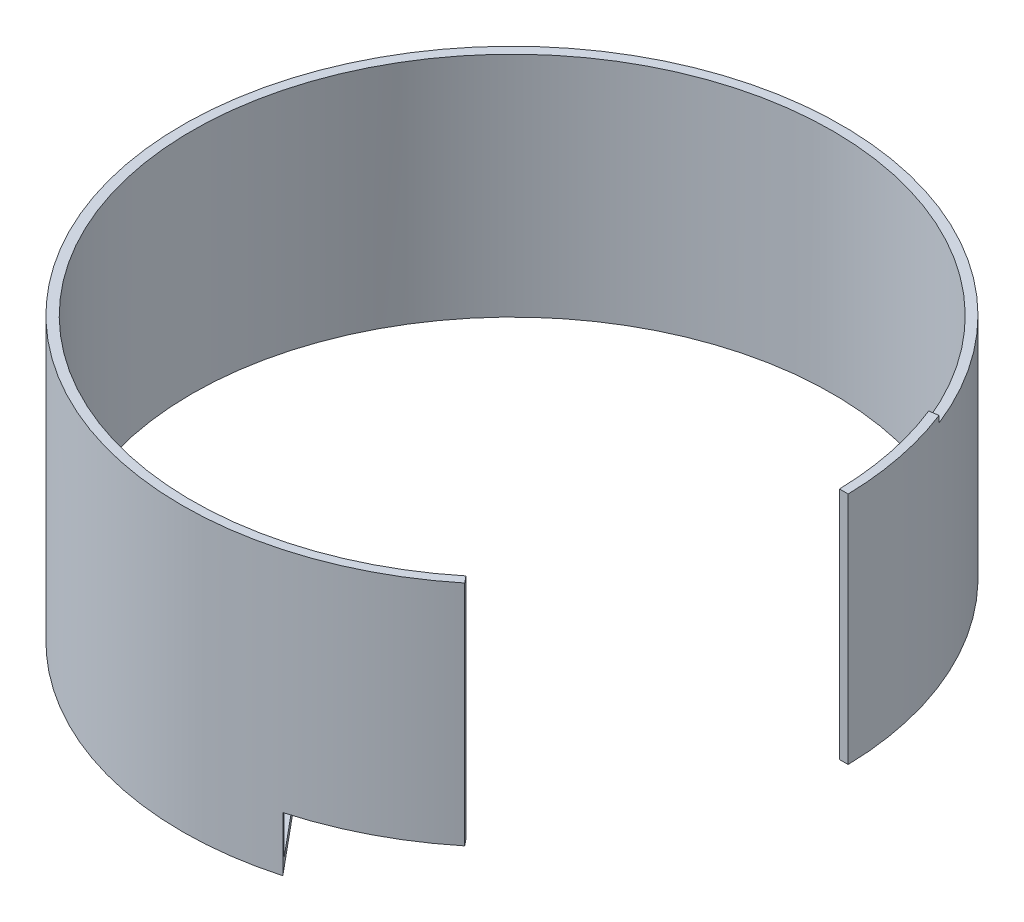
from build123d import *

# Parameters (mm, degrees)
BASE_FLANGE1_DEPTH  = 98.298
CUT_EXTRUDE1_START  = -19.939
CUT_EXTRUDE1_DEPTH  = 19.939
BOSS_EXTRUDE3_START = -3.175
SKETCH13_R          = 3.5
BOSS_EXTRUDE3_DEPTH = 3.175
BOSS_EXTRUDE4_START = 4.572
BOSS_EXTRUDE4_DEPTH = 4.572
BOSS_EXTRUDE5_START = 2.4115014
BOSS_EXTRUDE5_DEPTH = 2.4115014


# Sheet-metal steps are written as plain solids
with BuildPart() as part:
    # Sketch3 → Base-Flange1 (new body)
    with BuildSketch(Plane(origin=(0, 0, 0), x_dir=(1, 0, 0), z_dir=(0, 1, 0))):
        with BuildLine():
            Line((116.647348933, 2.54), (119.822348933, 2.54))
            ThreePointArc((119.822348933, 2.54), (-109.127582861, 50.474671088), (75.651891683, -92.955973295))
            Line((75.651891683, -92.955973295), (73.645289253, -90.495452836))
            ThreePointArc((73.645289253, -90.495452836), (-105.909021844, 48.952371802), (116.647348933, 2.54))
        make_face()
    extrude(amount=-BASE_FLANGE1_DEPTH)

    # Sketch11 → Cut-Extrude1 (cut)
    with BuildSketch(Plane.XZ.offset(98.298).offset(CUT_EXTRUDE1_START)):
        with BuildLine():
            Line((32.000435674, 115.55214828), (29.730194096, 112.823628607))
            ThreePointArc((29.730194096, 112.823628607), (52.879669985, 104.003827407), (73.645289253, 90.495452836))
            Line((73.645289253, 90.495452836), (75.651891683, 92.955973295))
            ThreePointArc((75.651891683, 92.955973295), (54.995189309, 106.512393046), (32.000435674, 115.55214828))
        make_face()
        with BuildLine():
            Line((-92.337333522, 76.828501251), (-89.68916988, 74.625119225))
            ThreePointArc((-89.68916988, 74.625119225), (-40.869300957, -109.282916562), (116.647348933, -2.54))
            Line((116.647348933, -2.54), (119.822348933, -2.54))
            ThreePointArc((119.822348933, -2.54), (-42.24188113, -112.507437016), (-92.337333522, 76.828501251))
        make_face()
    extrude(amount=CUT_EXTRUDE1_DEPTH, mode=Mode.SUBTRACT)

    # Sketch13 → Boss-Extrude3 (add)
    with BuildSketch(Plane.XZ.offset(98.298).offset(BOSS_EXTRUDE3_START)):
        with BuildLine():
            Line((-37.903446615, 31.537248793), (29.730194096, 112.823628607))
            ThreePointArc((29.730194096, 112.823628607), (-35.546465704, 111.128323973), (-89.68916988, 74.625119225))
            Line((-89.68916988, 74.625119225), (-37.903446615, 31.537248793))
        make_face()
        with Locations(Location((-10.621108202, 78.226237974, 0), (0, 0, 270))):
            Circle(SKETCH13_R, mode=Mode.SUBTRACT)
        with Locations(Location((10.39338393, 103.482781479, 0), (0, 0, 270))):
            Circle(SKETCH13_R, mode=Mode.SUBTRACT)
        with BuildLine():
            Line((-53.950312206, 61.001291051), (-21.551148637, 99.940651521))
            ThreePointArc((-21.551148637, 99.940651521), (-12.608395426, 100.76050822), (-11.788538727, 91.817755009))
            Line((-11.788538727, 91.817755009), (-44.187702296, 52.878394539))
            ThreePointArc((-44.187702296, 52.878394539), (-53.130455507, 52.05853784), (-53.950312206, 61.001291051))
        make_face(mode=Mode.SUBTRACT)
        with BuildLine():
            Line((-71.024350753, 77.519358691), (-51.203588088, 100.902170675))
            ThreePointArc((-51.203588088, 100.902170675), (-42.25369967, 101.640071282), (-41.515799064, 92.690182864))
            Line((-41.515799064, 92.690182864), (-61.336561728, 69.30737088))
            ThreePointArc((-61.336561728, 69.30737088), (-70.286450146, 68.569470273), (-71.024350753, 77.519358691))
        make_face(mode=Mode.SUBTRACT)
    extrude(amount=BOSS_EXTRUDE3_DEPTH)

    # Sketch14 → Boss-Extrude4 (add)
    with BuildSketch(Plane(origin=(0, 0, 0), x_dir=(1, 0, 0), z_dir=(0, 1, 0)).offset(BOSS_EXTRUDE4_START)):
        with BuildLine():
            Line((116.647348933, 2.54), (119.822348933, 2.54))
            ThreePointArc((119.822348933, 2.54), (-109.127582861, 50.474671088), (75.651891683, -92.955973295))
            Line((75.651891683, -92.955973295), (73.645289253, -90.495452836))
            ThreePointArc((73.645289253, -90.495452836), (-105.909021844, 48.952371802), (116.647348933, 2.54))
        make_face()
    extrude(amount=-BOSS_EXTRUDE4_DEPTH)

    # Sketch15 → Boss-Extrude5 (add)
    with BuildSketch(Plane(origin=(0, 4.572, 0), x_dir=(1, 0, 0), z_dir=(0, 1, 0)).offset(BOSS_EXTRUDE5_START)):
        with BuildLine():
            Line((116.647348933, 2.54), (119.822348933, 2.54))
            ThreePointArc((119.822348933, 2.54), (117.525772125, 23.578469398), (111.569940957, 43.886584395))
            Line((111.569940957, 43.886584395), (108.304935184, 43.394661284))
            ThreePointArc((108.304935184, 43.394661284), (114.316045984, 23.343034156), (116.647348933, 2.54))
        make_face()
    extrude(amount=-BOSS_EXTRUDE5_DEPTH)


solid = part.part
